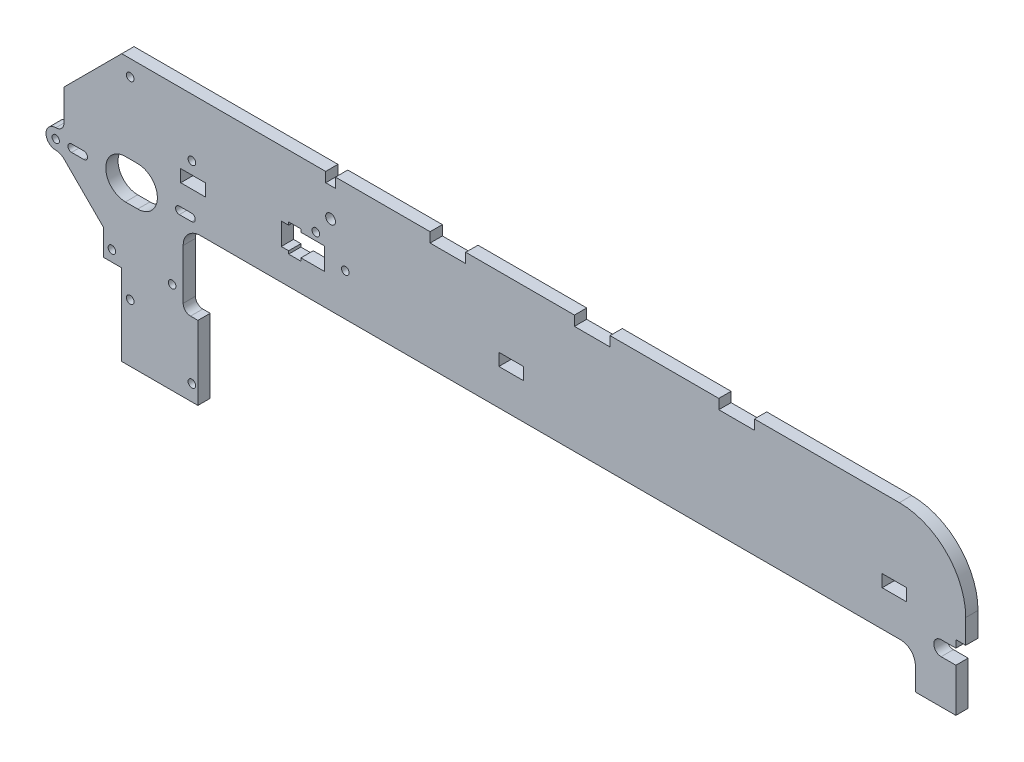
from build123d import *

# Parameters (mm, degrees)
SKETCH1_R           = 1.5
SKETCH1_R_2         = 8
SKETCH1_R_3         = 1.55
SKETCH1_R_4         = 2
SKETCH1_W           = 10
SKETCH1_H           = 5
BOSS_EXTRUDE1_DEPTH = 5
FILLET2_R           = 7
FILLET3_R           = 3
CUT_EXTRUDE1_DEPTH  = 344.247723955
FILLET4_R           = 6


with BuildPart() as part:
    # Sketch1 → Boss-Extrude1 (new body)
    with BuildSketch(Plane.XY):
        with BuildLine():
            Line((310, 43.5), (251, 43.5))
            Line((251, 43.5), (251, 39.5))
            Line((251, 39.5), (236.5, 39.5))
            Line((236.5, 39.5), (236.5, 43.5))
            Line((236.5, 43.5), (192.25, 43.5))
            Line((192.25, 43.5), (192.25, 39.5))
            Line((192.25, 39.5), (177.75, 39.5))
            Line((177.75, 39.5), (177.75, 43.5))
            Line((177.75, 43.5), (133.5, 43.5))
            Line((133.5, 43.5), (133.5, 39.5))
            Line((133.5, 39.5), (119, 39.5))
            Line((119, 39.5), (119, 43.5))
            Line((119, 43.5), (80.5, 43.5))
            Line((80.5, 43.5), (80.5, 39.5))
            Line((80.5, 39.5), (76.5, 39.5))
            Line((76.5, 39.5), (76.5, 43.5))
            Line((76.5, 43.5), (-6.5, 43.5))
            Line((-6.5, 43.5), (-30, 20))
            Line((-30, 20), (-30, 7.325414703))
            ThreePointArc((-30, 7.325414703), (-30.985037822, 4.947323034), (-33.36312949, 3.962285212))
            ThreePointArc((-33.36312949, 3.962285212), (-37.325414703, 0), (-33.36312949, -3.962285212))
            ThreePointArc((-33.36312949, -3.962285212), (-31.543016926, -4.324328111), (-30, -5.355339059))
            Line((-30, -5.355339059), (-14, -21.355339059))
            Line((-14, -21.355339059), (-14, -32))
            Line((-14, -32), (-6.5, -32))
            Line((-6.5, -32), (-6.5, -65))
            Line((-6.5, -65), (24.5, -65))
            Line((24.5, -65), (24.5, -35))
            Line((24.5, -35), (18.5, -35))
            Line((18.5, -35), (18.5, -4.6))
            Line((18.5, -4.6), (316.5, -4.6))
            Line((316.5, -4.6), (316.5, -20))
            Line((316.5, -20), (333, -20))
            Line((333, -20), (333, -2.3))
            Line((333, -2.3), (327, -2.3))
            ThreePointArc((327, -2.3), (324, 0.7), (327, 3.7))
            Line((327, 3.7), (333, 3.7))
            Line((333, 3.7), (333, 6.7))
            Line((333, 6.7), (337, 6.7))
            Line((337, 6.7), (337, 16.5))
            ThreePointArc((337, 16.5), (329.091883092, 35.591883092), (310, 43.5))
        make_face()
        with Locations((21.920310217, 0)):
            Circle(SKETCH1_R, mode=Mode.SUBTRACT)
        with Locations((-21.920310217, 0)):
            Circle(SKETCH1_R, mode=Mode.SUBTRACT)
        Circle(SKETCH1_R_2, mode=Mode.SUBTRACT)
        with Locations((-3.05, 37)):
            Circle(SKETCH1_R_3, mode=Mode.SUBTRACT)
        with Locations((22.05, 20)):
            Circle(SKETCH1_R_3, mode=Mode.SUBTRACT)
        with Locations((-3.05, -41.5)):
            Circle(SKETCH1_R_3, mode=Mode.SUBTRACT)
        with Locations((22.05, -58.5)):
            Circle(SKETCH1_R_3, mode=Mode.SUBTRACT)
        with Locations((72.5, 20.1)):
            Circle(SKETCH1_R_3, mode=Mode.SUBTRACT)
        with Locations((84.5, 12.5)):
            Circle(SKETCH1_R_3, mode=Mode.SUBTRACT)
        with Locations((-10.5, -27.55)):
            Circle(SKETCH1_R_3, mode=Mode.SUBTRACT)
        with Locations((14, -27.55)):
            Circle(SKETCH1_R_3, mode=Mode.SUBTRACT)
        with Locations((-33.36312949, 0)):
            Circle(SKETCH1_R, mode=Mode.SUBTRACT)
        with Locations((78.5, 27.751425951)):
            Circle(SKETCH1_R_4, mode=Mode.SUBTRACT)
        with Locations((22.5, 12.5)):
            Rectangle(SKETCH1_W, SKETCH1_H, mode=Mode.SUBTRACT)
        with Locations((152, 12.5)):
            Rectangle(SKETCH1_W, SKETCH1_H, mode=Mode.SUBTRACT)
        with Locations((308, 12.5)):
            Rectangle(SKETCH1_W, SKETCH1_H, mode=Mode.SUBTRACT)
        Polygon((58.427680349, 8), (61.427680349, 8), (61.427680349, 6.806102344), (66.427680349, 6.806102344), (66.427680349, 8), (76, 8), (76, 17), (66.427680349, 17), (66.427680349, 18.193897656), (61.427680349, 18.193897656), (61.427680349, 17), (58.427680349, 17), align=None, mode=Mode.SUBTRACT)
    extrude(amount=BOSS_EXTRUDE1_DEPTH)

    # Fillet2
    fillet2_edges = [part.edges().sort_by_distance(p)[0] for p in [
        (18.5, -4.6, 2.5),
    ]]
    fillet(fillet2_edges, radius=FILLET2_R)

    # Fillet3
    fillet3_edges = [part.edges().sort_by_distance(p)[0] for p in [
        (18.5, -35, 2.5),
    ]]
    fillet(fillet3_edges, radius=FILLET3_R)

    # Sketch2 → Cut-Extrude1 (cut, through all)
    with BuildSketch(Plane.XY.offset(5)):
        with BuildLine():
            Line((21.920310217, -1.5), (16.920310217, -1.5))
            ThreePointArc((16.920310217, -1.5), (15.420310217, 0), (16.920310217, 1.5))
            Line((16.920310217, 1.5), (21.920310217, 1.5))
            ThreePointArc((21.920310217, 1.5), (23.420310217, 0), (21.920310217, -1.5))
        make_face()
        with BuildLine():
            Line((0, -8), (-5, -8))
            ThreePointArc((-5, -8), (-13, 0), (-5, 8))
            Line((-5, 8), (0, 8))
            ThreePointArc((0, 8), (8, 0), (0, -8))
        make_face()
        with BuildLine():
            Line((-21.920310217, -1.5), (-26.920310217, -1.5))
            ThreePointArc((-26.920310217, -1.5), (-28.420310217, 0), (-26.920310217, 1.5))
            Line((-26.920310217, 1.5), (-21.920310217, 1.5))
            ThreePointArc((-21.920310217, 1.5), (-20.420310217, 0), (-21.920310217, -1.5))
        make_face()
    extrude(amount=-CUT_EXTRUDE1_DEPTH, mode=Mode.SUBTRACT)

    # Fillet4
    fillet4_edges = [part.edges().sort_by_distance(p)[0] for p in [
        (316.5, -4.6, 2.5),
    ]]
    fillet(fillet4_edges, radius=FILLET4_R)


solid = part.part
